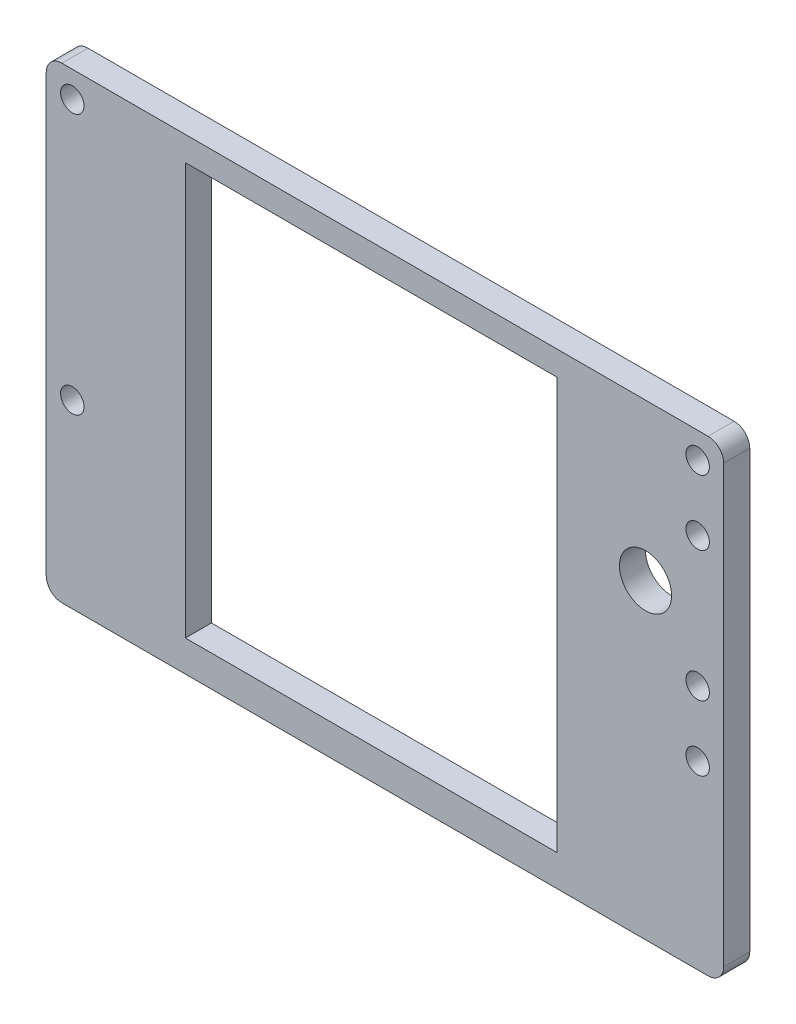
from build123d import *

# Parameters (mm, degrees)
SKETCH1_W           = 130
SKETCH1_H           = 89.679378249
SKETCH1_R           = 2.25
SKETCH1_W_2         = 71.3
SKETCH1_H_2         = 79
BOSS_EXTRUDE1_DEPTH = 5
FILLET1_R           = 3
SKETCH2_R           = 5
CUT_EXTRUDE1_DEPTH  = 5
SKETCH3_R           = 2.25
CUT_EXTRUDE2_DEPTH  = 5


with BuildPart() as part:
    # Sketch1 → Boss-Extrude1 (new body)
    with BuildSketch(Plane.XY):
        with Locations((65, -44.839689125)):
            Rectangle(SKETCH1_W, SKETCH1_H)
        with Locations((125, -5)):
            Circle(SKETCH1_R, mode=Mode.SUBTRACT)
        with Locations((125, -55)):
            Circle(SKETCH1_R, mode=Mode.SUBTRACT)
        with Locations((5, -55)):
            Circle(SKETCH1_R, mode=Mode.SUBTRACT)
        with Locations((5, -5)):
            Circle(SKETCH1_R, mode=Mode.SUBTRACT)
        with Locations((62.35, -44.179378249)):
            Rectangle(SKETCH1_W_2, SKETCH1_H_2, mode=Mode.SUBTRACT)
    extrude(amount=BOSS_EXTRUDE1_DEPTH)

    # Fillet1
    fillet1_edges = [part.edges().sort_by_distance(p)[0] for p in [
        (130, 0, 2.5),
        (130, -89.679378249, 2.5),
        (0, -89.679378249, 2.5),
        (0, 0, 2.5),
    ]]
    fillet(fillet1_edges, radius=FILLET1_R)

    # Sketch2 → Cut-Extrude1 (cut)
    with BuildSketch(Plane(origin=(0, 0, 0), x_dir=(-1, 0, 0), z_dir=(0, 0, -1))):
        with Locations((-115, -30)):
            Circle(SKETCH2_R)
    extrude(amount=-CUT_EXTRUDE1_DEPTH, mode=Mode.SUBTRACT)

    # Sketch3 → Cut-Extrude2 (cut)
    with BuildSketch(Plane.XY.offset(5)):
        with Locations((125, -42.5)):
            Circle(SKETCH3_R)
        with Locations((125, -17.5)):
            Circle(SKETCH3_R)
    extrude(amount=-CUT_EXTRUDE2_DEPTH, mode=Mode.SUBTRACT)


solid = part.part
